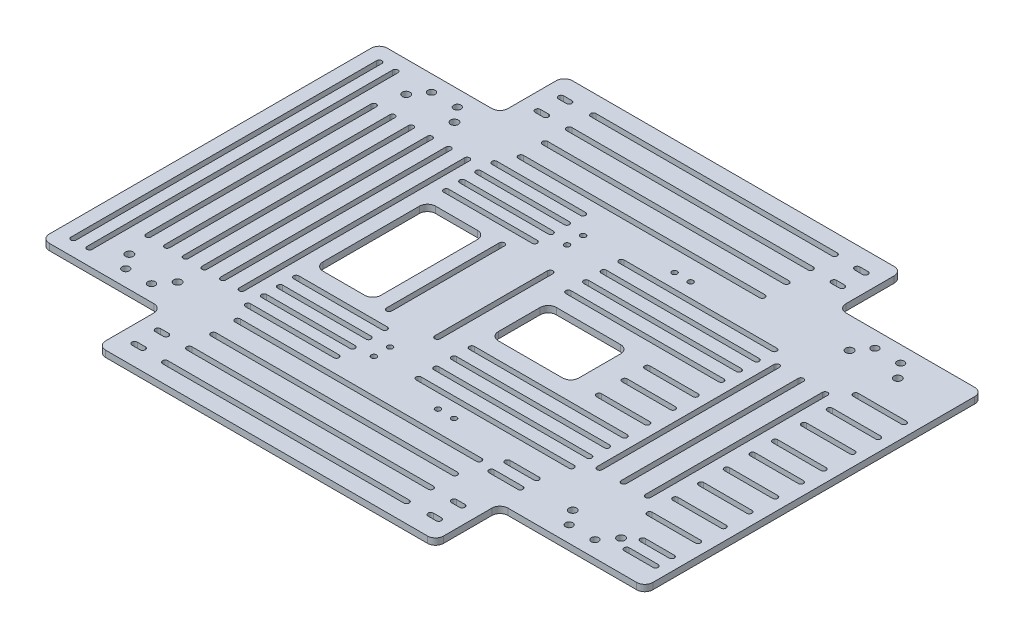
from build123d import *

# Parameters (mm, degrees)
EXTRUDE_1_DEPTH            = 4
SKETCH_3_R                 = 2.4
SKETCH_3_R_2               = 2.25
CUT_EXTRUDE_1_DEPTH        = 10
CUT_EXTRUDE_2_DEPTH        = 10
SKETCH_5_R                 = 1.65
CUT_EXTRUDE_3_DEPTH        = 10
SKETCH_7_R                 = 1.65
CUT_EXTRUDE_4_DEPTH        = 10
CUT_EXTRUDE_5_DEPTH        = 10
CUT_EXTRUDE_6_DEPTH        = 10
CUT_EXTRUDE_9_DEPTH        = 10
SKETCH_13_W                = 20
SKETCH_13_H                = 210
EXTRUDE_2_DEPTH            = 4
CUT_EXTRUDE_10_DEPTH       = 10
SKETCH_15_W                = 20
SKETCH_15_H                = 210
EXTRUDE_3_DEPTH            = 4
FILLET_1_R                 = 5
CUT_EXTRUDE_12_DEPTH       = 10
PATTERN_LINEAR_1_COUNT     = 2
PATTERN_LINEAR_1_PITCH     = 10
CUT_EXTRUDE_13_DEPTH       = 10
CUT_EXTRUDE_15_DEPTH       = 4
CUT_EXTRUDE_16_OUTLINE_W   = 36
CUT_EXTRUDE_16_OUTLINE_H   = 70
CUT_EXTRUDE_16_OUTLINE_W_2 = 50
CUT_EXTRUDE_16_OUTLINE_H_2 = 36
CUT_EXTRUDE_16_DEPTH       = 4
CUT_EXTRUDE_17_DEPTH       = 52
CUT_EXTRUDE_18_DEPTH       = 52
CUT_EXTRUDE_19_DEPTH       = 52
FILLET_2_R                 = 5


# Read off the part's stored shape, not the designer's step: 切除-拉伸15, 切除-拉伸16
with BuildPart() as part:
    # 草图1 → 凸台-拉伸1 (new body)
    with BuildSketch(Plane(origin=(0, 0, 0), x_dir=(1, 0, 0), z_dir=(0, 1, 0))):
        Polygon((0, 0), (210, 0), (210, 40), (280, 40), (280, 250), (210, 250), (210, 290), (0, 290), (0, 250), (-55, 250), (-55, 40), (0, 40), align=None)
    extrude(amount=EXTRUDE_1_DEPTH)

    # 草图3 → 切除-拉伸1 (cut)
    with BuildSketch(Plane.XZ):
        with Locations(Location((-9.26, -59, 0), (0, 0, 270))):
            Circle(SKETCH_3_R)
        with Locations(Location((-39.26, -59, 0), (0, 0, 270))):
            Circle(SKETCH_3_R)
        with Locations(Location((-9.26, -231, 0), (0, 0, 270))):
            Circle(SKETCH_3_R)
        with Locations(Location((-39.26, -231, 0), (0, 0, 270))):
            Circle(SKETCH_3_R)
        with Locations(Location((236.26, -59, 0), (0, 0, 270))):
            Circle(SKETCH_3_R)
        with Locations(Location((266.26, -59, 0), (0, 0, 270))):
            Circle(SKETCH_3_R)
        with Locations(Location((236.26, -231, 0), (0, 0, 270))):
            Circle(SKETCH_3_R)
        with Locations(Location((266.26, -231, 0), (0, 0, 270))):
            Circle(SKETCH_3_R)
        with Locations(Location((-16.51, -240, 0), (0, 0, 270))):
            Circle(SKETCH_3_R_2)
        with Locations(Location((-32.51, -240, 0), (0, 0, 270))):
            Circle(SKETCH_3_R_2)
        with Locations(Location((-16.51, -50, 0), (0, 0, 270))):
            Circle(SKETCH_3_R_2)
        with Locations(Location((-32.51, -50, 0), (0, 0, 270))):
            Circle(SKETCH_3_R_2)
        with Locations(Location((259.01, -50, 0), (0, 0, 270))):
            Circle(SKETCH_3_R_2)
        with Locations(Location((243.01, -50, 0), (0, 0, 270))):
            Circle(SKETCH_3_R_2)
        with Locations(Location((259.01, -240, 0), (0, 0, 270))):
            Circle(SKETCH_3_R_2)
        with Locations(Location((243.01, -240, 0), (0, 0, 270))):
            Circle(SKETCH_3_R_2)
    extrude(amount=-CUT_EXTRUDE_1_DEPTH, mode=Mode.SUBTRACT)

    # 草图4 → 切除-拉伸2 (cut)
    with BuildSketch(Plane(origin=(0, 4, 0), x_dir=(1, 0, 0), z_dir=(0, 1, 0))):
        with BuildLine():
            Line((194.5, 279.15), (199.5, 279.15))
            ThreePointArc((199.5, 279.15), (201.15, 277.5), (199.5, 275.85))
            Line((199.5, 275.85), (194.5, 275.85))
            ThreePointArc((194.5, 275.85), (192.85, 277.5), (194.5, 279.15))
        make_face()
        with BuildLine():
            Line((194.5, 264.65), (199.5, 264.65))
            ThreePointArc((199.5, 264.65), (201.15, 263), (199.5, 261.35))
            Line((199.5, 261.35), (194.5, 261.35))
            ThreePointArc((194.5, 261.35), (192.85, 263), (194.5, 264.65))
        make_face()
        with BuildLine():
            Line((194.5, 25.35), (199.5, 25.35))
            ThreePointArc((199.5, 25.35), (201.15, 27), (199.5, 28.65))
            Line((199.5, 28.65), (194.5, 28.65))
            ThreePointArc((194.5, 28.65), (192.85, 27), (194.5, 25.35))
        make_face()
        with BuildLine():
            Line((194.5, 10.85), (199.5, 10.85))
            ThreePointArc((199.5, 10.85), (201.15, 12.5), (199.5, 14.15))
            Line((199.5, 14.15), (194.5, 14.15))
            ThreePointArc((194.5, 14.15), (192.85, 12.5), (194.5, 10.85))
        make_face()
        with BuildLine():
            Line((15.5, 10.85), (10.5, 10.85))
            ThreePointArc((10.5, 10.85), (8.85, 12.5), (10.5, 14.15))
            Line((10.5, 14.15), (15.5, 14.15))
            ThreePointArc((15.5, 14.15), (17.15, 12.5), (15.5, 10.85))
        make_face()
        with BuildLine():
            Line((15.5, 25.35), (10.5, 25.35))
            ThreePointArc((10.5, 25.35), (8.85, 27), (10.5, 28.65))
            Line((10.5, 28.65), (15.5, 28.65))
            ThreePointArc((15.5, 28.65), (17.15, 27), (15.5, 25.35))
        make_face()
        with BuildLine():
            Line((15.5, 264.65), (10.5, 264.65))
            ThreePointArc((10.5, 264.65), (8.85, 263), (10.5, 261.35))
            Line((10.5, 261.35), (15.5, 261.35))
            ThreePointArc((15.5, 261.35), (17.15, 263), (15.5, 264.65))
        make_face()
        with BuildLine():
            Line((15.5, 279.15), (10.5, 279.15))
            ThreePointArc((10.5, 279.15), (8.85, 277.5), (10.5, 275.85))
            Line((10.5, 275.85), (15.5, 275.85))
            ThreePointArc((15.5, 275.85), (17.15, 277.5), (15.5, 279.15))
        make_face()
    extrude(amount=-CUT_EXTRUDE_2_DEPTH, mode=Mode.SUBTRACT)

    # 草图5 → 切除-拉伸3 (cut)
    with BuildSketch(Plane(origin=(0, 4, 0), x_dir=(1, 0, 0), z_dir=(0, 1, 0))):
        with Locations(Location((140, 218.5, 0), (0, 0, 270))):
            Circle(SKETCH_5_R)
        with Locations(Location((150, 218.5, 0), (0, 0, 270))):
            Circle(SKETCH_5_R)
        with Locations(Location((150, 71.5, 0), (0, 0, 270))):
            Circle(SKETCH_5_R)
        with Locations(Location((140, 71.5, 0), (0, 0, 270))):
            Circle(SKETCH_5_R)
    extrude(amount=-CUT_EXTRUDE_3_DEPTH, mode=Mode.SUBTRACT)

    # 草图7 → 切除-拉伸4 (cut)
    with BuildSketch(Plane(origin=(0, 4, 0), x_dir=(1, 0, 0), z_dir=(0, 1, 0))):
        with Locations(Location((91.7027819, 210, 0), (0, 0, 270))):
            Circle(SKETCH_7_R)
        with Locations(Location((91.7027819, 200, 0), (0, 0, 270))):
            Circle(SKETCH_7_R)
        with Locations(Location((91.7027819, 90, 0), (0, 0, 270))):
            Circle(SKETCH_7_R)
        with Locations(Location((91.7027819, 80, 0), (0, 0, 270))):
            Circle(SKETCH_7_R)
    extrude(amount=-CUT_EXTRUDE_4_DEPTH, mode=Mode.SUBTRACT)

    # 草图8 → 切除-拉伸5 (cut)
    with BuildSketch(Plane(origin=(0, 4, 0), x_dir=(1, 0, 0), z_dir=(0, 1, 0))):
        with BuildLine():
            Line((69.55, 180), (69.55, 110))
            ThreePointArc((69.55, 110), (71.2, 108.35), (72.85, 110))
            Line((72.85, 110), (72.85, 180))
            ThreePointArc((72.85, 180), (71.2, 181.65), (69.55, 180))
        make_face()
        with BuildLine():
            Line((102.85, 180), (102.85, 110))
            ThreePointArc((102.85, 110), (101.2, 108.35), (99.55, 110))
            Line((99.55, 110), (99.55, 180))
            ThreePointArc((99.55, 180), (101.2, 181.65), (102.85, 180))
        make_face()
    extrude(amount=-CUT_EXTRUDE_5_DEPTH, mode=Mode.SUBTRACT)

    # 草图9 → 切除-拉伸6 (cut)
    with BuildSketch(Plane(origin=(0, 4, 0), x_dir=(1, 0, 0), z_dir=(0, 1, 0))):
        with BuildLine():
            Line((30, 279.65), (180, 279.65))
            ThreePointArc((180, 279.65), (181.65, 278), (180, 276.35))
            Line((180, 276.35), (30, 276.35))
            ThreePointArc((30, 276.35), (28.35, 278), (30, 279.65))
        make_face()
        with BuildLine():
            Line((30, 264.65), (180, 264.65))
            ThreePointArc((180, 264.65), (181.65, 263), (180, 261.35))
            Line((180, 261.35), (30, 261.35))
            ThreePointArc((30, 261.35), (28.35, 263), (30, 264.65))
        make_face()
        with BuildLine():
            Line((30, 249.65), (180, 249.65))
            ThreePointArc((180, 249.65), (181.65, 248), (180, 246.35))
            Line((180, 246.35), (30, 246.35))
            ThreePointArc((30, 246.35), (28.35, 248), (30, 249.65))
        make_face()
        with BuildLine():
            Line((30, 234.65), (180, 234.65))
            ThreePointArc((180, 234.65), (181.65, 233), (180, 231.35))
            Line((180, 231.35), (30, 231.35))
            ThreePointArc((30, 231.35), (28.35, 233), (30, 234.65))
        make_face()
        with BuildLine():
            Line((30, 55.35), (180, 55.35))
            ThreePointArc((180, 55.35), (181.65, 57), (180, 58.65))
            Line((180, 58.65), (30, 58.65))
            ThreePointArc((30, 58.65), (28.35, 57), (30, 55.35))
        make_face()
        with BuildLine():
            Line((30, 40.35), (180, 40.35))
            ThreePointArc((180, 40.35), (181.65, 42), (180, 43.65))
            Line((180, 43.65), (30, 43.65))
            ThreePointArc((30, 43.65), (28.35, 42), (30, 40.35))
        make_face()
        with BuildLine():
            Line((30, 25.35), (180, 25.35))
            ThreePointArc((180, 25.35), (181.65, 27), (180, 28.65))
            Line((180, 28.65), (30, 28.65))
            ThreePointArc((30, 28.65), (28.35, 27), (30, 25.35))
        make_face()
        with BuildLine():
            Line((30, 10.35), (180, 10.35))
            ThreePointArc((180, 10.35), (181.65, 12), (180, 13.65))
            Line((180, 13.65), (30, 13.65))
            ThreePointArc((30, 13.65), (28.35, 12), (30, 10.35))
        make_face()
    extrude(amount=-CUT_EXTRUDE_6_DEPTH, mode=Mode.SUBTRACT)

    # 草图12 → 切除-拉伸9 (cut)
    with BuildSketch(Plane(origin=(0, 4, 0), x_dir=(1, 0, 0), z_dir=(0, 1, 0))):
        with BuildLine():
            Line((253.65, 200), (253.65, 90))
            ThreePointArc((253.65, 90), (252, 88.35), (250.35, 90))
            Line((250.35, 90), (250.35, 200))
            ThreePointArc((250.35, 200), (252, 201.65), (253.65, 200))
        make_face()
        with BuildLine():
            Line((238.65, 200), (238.65, 90))
            ThreePointArc((238.65, 90), (237, 88.35), (235.35, 90))
            Line((235.35, 90), (235.35, 200))
            ThreePointArc((235.35, 200), (237, 201.65), (238.65, 200))
        make_face()
        with BuildLine():
            Line((223.65, 200), (223.65, 90))
            ThreePointArc((223.65, 90), (222, 88.35), (220.35, 90))
            Line((220.35, 90), (220.35, 200))
            ThreePointArc((220.35, 200), (222, 201.65), (223.65, 200))
        make_face()
    extrude(amount=-CUT_EXTRUDE_9_DEPTH, mode=Mode.SUBTRACT)

    # 草图13 → 凸台-拉伸2 (add)
    with BuildSketch(Plane(origin=(0, 4, 0), x_dir=(1, 0, 0), z_dir=(0, 1, 0))):
        with Locations((290, 145)):
            Rectangle(SKETCH_13_W, SKETCH_13_H)
    extrude(amount=-EXTRUDE_2_DEPTH)

    # 草图14 → 切除-拉伸10 (cut)
    with BuildSketch(Plane(origin=(0, 4, 0), x_dir=(1, 0, 0), z_dir=(0, 1, 0))):
        with BuildLine():
            Line((212.5, 157.421985317), (182.5, 157.421985317))
            ThreePointArc((182.5, 157.421985317), (180.9, 159.021985317), (182.5, 160.621985317))
            Line((182.5, 160.621985317), (212.5, 160.621985317))
            ThreePointArc((212.5, 160.621985317), (214.1, 159.021985317), (212.5, 157.421985317))
        make_face()
        with BuildLine():
            Line((292, 157.421985317), (262, 157.421985317))
            ThreePointArc((262, 157.421985317), (260.4, 159.021985317), (262, 160.621985317))
            Line((262, 160.621985317), (292, 160.621985317))
            ThreePointArc((292, 160.621985317), (293.6, 159.021985317), (292, 157.421985317))
        make_face()
        with BuildLine():
            Line((292, 63.129690274), (274, 63.129690274))
            ThreePointArc((274, 63.129690274), (272.4, 64.729690274), (274, 66.329690274))
            Line((274, 66.329690274), (292, 66.329690274))
            ThreePointArc((292, 66.329690274), (293.6, 64.729690274), (292, 63.129690274))
        make_face()
        with BuildLine():
            Line((292, 53.129690274), (274, 53.129690274))
            ThreePointArc((274, 53.129690274), (272.4, 54.729690274), (274, 56.329690274))
            Line((274, 56.329690274), (292, 56.329690274))
            ThreePointArc((292, 56.329690274), (293.6, 54.729690274), (292, 53.129690274))
        make_face()
        with BuildLine():
            Line((208, 63.129690274), (190, 63.129690274))
            ThreePointArc((190, 63.129690274), (188.4, 64.729690274), (190, 66.329690274))
            Line((190, 66.329690274), (208, 66.329690274))
            ThreePointArc((208, 66.329690274), (209.6, 64.729690274), (208, 63.129690274))
        make_face()
        with BuildLine():
            Line((208, 53.129690274), (190, 53.129690274))
            ThreePointArc((190, 53.129690274), (188.4, 54.729690274), (190, 56.329690274))
            Line((190, 56.329690274), (208, 56.329690274))
            ThreePointArc((208, 56.329690274), (209.6, 54.729690274), (208, 53.129690274))
        make_face()
    extrude(amount=-CUT_EXTRUDE_10_DEPTH, mode=Mode.SUBTRACT)

    # 草图15 → 凸台-拉伸3 (add)
    with BuildSketch(Plane.XZ):
        with Locations((-65, -145)):
            Rectangle(SKETCH_15_W, SKETCH_15_H)
    extrude(amount=-EXTRUDE_3_DEPTH)

    # 圆角1
    fillet_1_edges = [part.edges().sort_by_distance(p)[0] for p in [
        (0, 2, -40),
        (0, 2, -250),
        (0, 2, -290),
        (210, 2, -290),
        (210, 2, -250),
        (210, 2, -40),
        (210, 2, 0),
        (0, 2, 0),
        (300, 2, -250),
        (300, 2, -40),
        (-75, 2, -250),
        (-75, 2, -40),
    ]]
    fillet(fillet_1_edges, radius=FILLET_1_R)

    # 草图18 → 切除-拉伸12 (cut)
    with BuildSketch(Plane(origin=(0, 4, 0), x_dir=(1, 0, 0), z_dir=(0, 1, 0))):
        with BuildLine():
            Line((-63.4, 240), (-63.4, 50))
            ThreePointArc((-63.4, 50), (-65, 48.4), (-66.6, 50))
            Line((-66.6, 50), (-66.6, 240))
            ThreePointArc((-66.6, 240), (-65, 241.6), (-63.4, 240))
        make_face()
    cut_extrude_12 = extrude(amount=-CUT_EXTRUDE_12_DEPTH, mode=Mode.SUBTRACT)

    # 阵列(线性)1: 切除-拉伸12 ×2
    with Locations(*[(i * PATTERN_LINEAR_1_PITCH, 0, 0) for i in range(1, PATTERN_LINEAR_1_COUNT)]):
        add(cut_extrude_12, mode=Mode.SUBTRACT)

    # 草图19 → 切除-拉伸13 (cut)
    with BuildSketch(Plane(origin=(0, 4, 0), x_dir=(1, 0, 0), z_dir=(0, 1, 0))):
        with BuildLine():
            Line((-45, 75), (-45, 215))
            ThreePointArc((-45, 215), (-43.4, 216.6), (-41.8, 215))
            Line((-41.8, 215), (-41.8, 75))
            ThreePointArc((-41.8, 75), (-43.4, 73.4), (-45, 75))
        make_face()
    extrude(amount=-CUT_EXTRUDE_13_DEPTH, mode=Mode.SUBTRACT)

    # 切除-拉伸15 outline → 切除-拉伸15 (cut)
    with BuildSketch(Plane(origin=(0, 0, 0), x_dir=(1, 0, 0), z_dir=(0, 1, 0))):
        with BuildLine():
            ThreePointArc((13, 75), (14.6, 73.4), (16.2, 75))
            Line((16.2, 75), (16.2, 215))
            ThreePointArc((16.2, 215), (14.6, 216.6), (13, 215))
            Line((13, 215), (13, 75))
        make_face()
        with BuildLine():
            ThreePointArc((1.4, 75), (3, 73.4), (4.6, 75))
            Line((4.6, 75), (4.6, 215))
            ThreePointArc((4.6, 215), (3, 216.6), (1.4, 215))
            Line((1.4, 215), (1.4, 75))
        make_face()
        with BuildLine():
            ThreePointArc((-10.2, 75), (-8.6, 73.4), (-7, 75))
            Line((-7, 75), (-7, 215))
            ThreePointArc((-7, 215), (-8.6, 216.6), (-10.2, 215))
            Line((-10.2, 215), (-10.2, 75))
        make_face()
        with BuildLine():
            ThreePointArc((-21.8, 75), (-20.2, 73.4), (-18.6, 75))
            Line((-18.6, 75), (-18.6, 215))
            ThreePointArc((-18.6, 215), (-20.2, 216.6), (-21.8, 215))
            Line((-21.8, 215), (-21.8, 75))
        make_face()
        with BuildLine():
            Line((-33.4, 215), (-33.4, 75))
            ThreePointArc((-33.4, 75), (-31.8, 73.4), (-30.2, 75))
            Line((-30.2, 75), (-30.2, 215))
            ThreePointArc((-30.2, 215), (-31.8, 216.6), (-33.4, 215))
        make_face()
        with BuildLine():
            Line((292, 146.6), (262, 146.6))
            ThreePointArc((262, 146.6), (260.4, 145), (262, 143.4))
            Line((262, 143.4), (292, 143.4))
            ThreePointArc((292, 143.4), (293.6, 145), (292, 146.6))
        make_face()
    extrude(amount=CUT_EXTRUDE_15_DEPTH, mode=Mode.SUBTRACT)

    # 切除-拉伸16 outline → 切除-拉伸16 (cut)
    with BuildSketch(Plane(origin=(0, 0, 0), x_dir=(1, 0, 0), z_dir=(0, 1, 0))):
        with BuildLine():
            Line((292, 130.6), (262, 130.6))
            ThreePointArc((262, 130.6), (260.4, 129), (262, 127.4))
            Line((262, 127.4), (292, 127.4))
            ThreePointArc((292, 127.4), (293.6, 129), (292, 130.6))
        make_face()
        with BuildLine():
            Line((292, 178.6), (262, 178.6))
            ThreePointArc((262, 178.6), (260.4, 177), (262, 175.4))
            Line((262, 175.4), (292, 175.4))
            ThreePointArc((292, 175.4), (293.6, 177), (292, 178.6))
        make_face()
        with BuildLine():
            Line((292, 82.6), (262, 82.6))
            ThreePointArc((262, 82.6), (260.4, 81), (262, 79.4))
            Line((262, 79.4), (292, 79.4))
            ThreePointArc((292, 79.4), (293.6, 81), (292, 82.6))
        make_face()
        with BuildLine():
            Line((292, 98.6), (262, 98.6))
            ThreePointArc((262, 98.6), (260.4, 97), (262, 95.4))
            Line((262, 95.4), (292, 95.4))
            ThreePointArc((292, 95.4), (293.6, 97), (292, 98.6))
        make_face()
        with BuildLine():
            Line((292, 114.6), (262, 114.6))
            ThreePointArc((262, 114.6), (260.4, 113), (262, 111.4))
            Line((262, 111.4), (292, 111.4))
            ThreePointArc((292, 111.4), (293.6, 113), (292, 114.6))
        make_face()
        with BuildLine():
            Line((292, 194.6), (262, 194.6))
            ThreePointArc((262, 194.6), (260.4, 193), (262, 191.4))
            Line((262, 191.4), (292, 191.4))
            ThreePointArc((292, 191.4), (293.6, 193), (292, 194.6))
        make_face()
        with BuildLine():
            Line((292, 210.6), (262, 210.6))
            ThreePointArc((262, 210.6), (260.4, 209), (262, 207.4))
            Line((262, 207.4), (292, 207.4))
            ThreePointArc((292, 207.4), (293.6, 209), (292, 210.6))
        make_face()
        with Locations((43, 145)):
            Rectangle(CUT_EXTRUDE_16_OUTLINE_W, CUT_EXTRUDE_16_OUTLINE_H)
        with Locations((142, 145)):
            Rectangle(CUT_EXTRUDE_16_OUTLINE_W_2, CUT_EXTRUDE_16_OUTLINE_H_2)
    extrude(amount=CUT_EXTRUDE_16_DEPTH, mode=Mode.SUBTRACT)

    # 草图23 → 切除-拉伸17 (cut)
    with BuildSketch(Plane(origin=(0, 4, 0), x_dir=(1, 0, 0), z_dir=(0, 1, 0))):
        with BuildLine():
            Line((117.5, 116.6), (212.5, 116.6))
            ThreePointArc((212.5, 116.6), (214.1, 115), (212.5, 113.4))
            Line((212.5, 113.4), (117.5, 113.4))
            ThreePointArc((117.5, 113.4), (115.9, 115), (117.5, 116.6))
        make_face()
        with BuildLine():
            Line((117.5, 105.6), (212.5, 105.6))
            ThreePointArc((212.5, 105.6), (214.1, 104), (212.5, 102.4))
            Line((212.5, 102.4), (117.5, 102.4))
            ThreePointArc((117.5, 102.4), (115.9, 104), (117.5, 105.6))
        make_face()
        with BuildLine():
            Line((117.5, 94.6), (212.5, 94.6))
            ThreePointArc((212.5, 94.6), (214.1, 93), (212.5, 91.4))
            Line((212.5, 91.4), (117.5, 91.4))
            ThreePointArc((117.5, 91.4), (115.9, 93), (117.5, 94.6))
        make_face()
        with BuildLine():
            Line((117.5, 83.6), (212.5, 83.6))
            ThreePointArc((212.5, 83.6), (214.1, 82), (212.5, 80.4))
            Line((212.5, 80.4), (117.5, 80.4))
            ThreePointArc((117.5, 80.4), (115.9, 82), (117.5, 83.6))
        make_face()
        with BuildLine():
            Line((117.5, 206.4), (212.5, 206.4))
            ThreePointArc((212.5, 206.4), (214.1, 208), (212.5, 209.6))
            Line((212.5, 209.6), (117.5, 209.6))
            ThreePointArc((117.5, 209.6), (115.9, 208), (117.5, 206.4))
        make_face()
        with BuildLine():
            Line((117.5, 195.4), (212.5, 195.4))
            ThreePointArc((212.5, 195.4), (214.1, 197), (212.5, 198.6))
            Line((212.5, 198.6), (117.5, 198.6))
            ThreePointArc((117.5, 198.6), (115.9, 197), (117.5, 195.4))
        make_face()
        with BuildLine():
            Line((117.5, 184.4), (212.5, 184.4))
            ThreePointArc((212.5, 184.4), (214.1, 186), (212.5, 187.6))
            Line((212.5, 187.6), (117.5, 187.6))
            ThreePointArc((117.5, 187.6), (115.9, 186), (117.5, 184.4))
        make_face()
        with BuildLine():
            Line((117.5, 173.4), (212.5, 173.4))
            ThreePointArc((212.5, 173.4), (214.1, 175), (212.5, 176.6))
            Line((212.5, 176.6), (117.5, 176.6))
            ThreePointArc((117.5, 176.6), (115.9, 175), (117.5, 173.4))
        make_face()
    extrude(amount=-CUT_EXTRUDE_17_DEPTH, mode=Mode.SUBTRACT)

    # 草图24 → 切除-拉伸18 (cut)
    with BuildSketch(Plane(origin=(0, 4, 0), x_dir=(1, 0, 0), z_dir=(0, 1, 0))):
        with BuildLine():
            Line((25, 100), (80, 100))
            ThreePointArc((80, 100), (81.6, 98.4), (80, 96.8))
            Line((80, 96.8), (25, 96.8))
            ThreePointArc((25, 96.8), (23.4, 98.4), (25, 100))
        make_face()
        with BuildLine():
            Line((25, 90), (80, 90))
            ThreePointArc((80, 90), (81.6, 88.4), (80, 86.8))
            Line((80, 86.8), (25, 86.8))
            ThreePointArc((25, 86.8), (23.4, 88.4), (25, 90))
        make_face()
        with BuildLine():
            Line((25, 80), (80, 80))
            ThreePointArc((80, 80), (81.6, 78.4), (80, 76.8))
            Line((80, 76.8), (25, 76.8))
            ThreePointArc((25, 76.8), (23.4, 78.4), (25, 80))
        make_face()
        with BuildLine():
            Line((25, 70), (80, 70))
            ThreePointArc((80, 70), (81.6, 68.4), (80, 66.8))
            Line((80, 66.8), (25, 66.8))
            ThreePointArc((25, 66.8), (23.4, 68.4), (25, 70))
        make_face()
        with BuildLine():
            Line((25, 220), (80, 220))
            ThreePointArc((80, 220), (81.6, 221.6), (80, 223.2))
            Line((80, 223.2), (25, 223.2))
            ThreePointArc((25, 223.2), (23.4, 221.6), (25, 220))
        make_face()
        with BuildLine():
            Line((25, 210), (80, 210))
            ThreePointArc((80, 210), (81.6, 211.6), (80, 213.2))
            Line((80, 213.2), (25, 213.2))
            ThreePointArc((25, 213.2), (23.4, 211.6), (25, 210))
        make_face()
        with BuildLine():
            Line((25, 200), (80, 200))
            ThreePointArc((80, 200), (81.6, 201.6), (80, 203.2))
            Line((80, 203.2), (25, 203.2))
            ThreePointArc((25, 203.2), (23.4, 201.6), (25, 200))
        make_face()
        with BuildLine():
            Line((25, 190), (80, 190))
            ThreePointArc((80, 190), (81.6, 191.6), (80, 193.2))
            Line((80, 193.2), (25, 193.2))
            ThreePointArc((25, 193.2), (23.4, 191.6), (25, 190))
        make_face()
    extrude(amount=-CUT_EXTRUDE_18_DEPTH, mode=Mode.SUBTRACT)

    # 草图25 → 切除-拉伸19 (cut)
    with BuildSketch(Plane(origin=(0, 4, 0), x_dir=(1, 0, 0), z_dir=(0, 1, 0))):
        with BuildLine():
            Line((182.5, 157.421985317), (212.5, 157.421985317))
            ThreePointArc((212.5, 157.421985317), (214.1, 159.021985317), (212.5, 160.621985317))
            Line((212.5, 160.621985317), (182.5, 160.621985317))
            ThreePointArc((182.5, 160.621985317), (180.9, 159.021985317), (182.5, 157.421985317))
        make_face()
        with BuildLine():
            Line((212.5, 146.601985317), (182.5, 146.601985317))
            ThreePointArc((182.5, 146.601985317), (180.9, 145.001985317), (182.5, 143.401985317))
            Line((182.5, 143.401985317), (212.5, 143.401985317))
            ThreePointArc((212.5, 143.401985317), (214.1, 145.001985317), (212.5, 146.601985317))
        make_face()
        with BuildLine():
            Line((212.5, 130.601985317), (182.5, 130.601985317))
            ThreePointArc((182.5, 130.601985317), (180.9, 129.001985317), (182.5, 127.401985317))
            Line((182.5, 127.401985317), (212.5, 127.401985317))
            ThreePointArc((212.5, 127.401985317), (214.1, 129.001985317), (212.5, 130.601985317))
        make_face()
    extrude(amount=-CUT_EXTRUDE_19_DEPTH, mode=Mode.SUBTRACT)

    # 圆角2
    fillet_2_edges = [part.edges().sort_by_distance(p)[0] for p in [
        (167, 2, -163),
        (167, 2, -127),
        (117, 2, -127),
        (117, 2, -163),
        (61, 2, -180),
        (61, 2, -110),
        (25, 2, -110),
        (25, 2, -180),
    ]]
    fillet(fillet_2_edges, radius=FILLET_2_R)


solid = part.part
